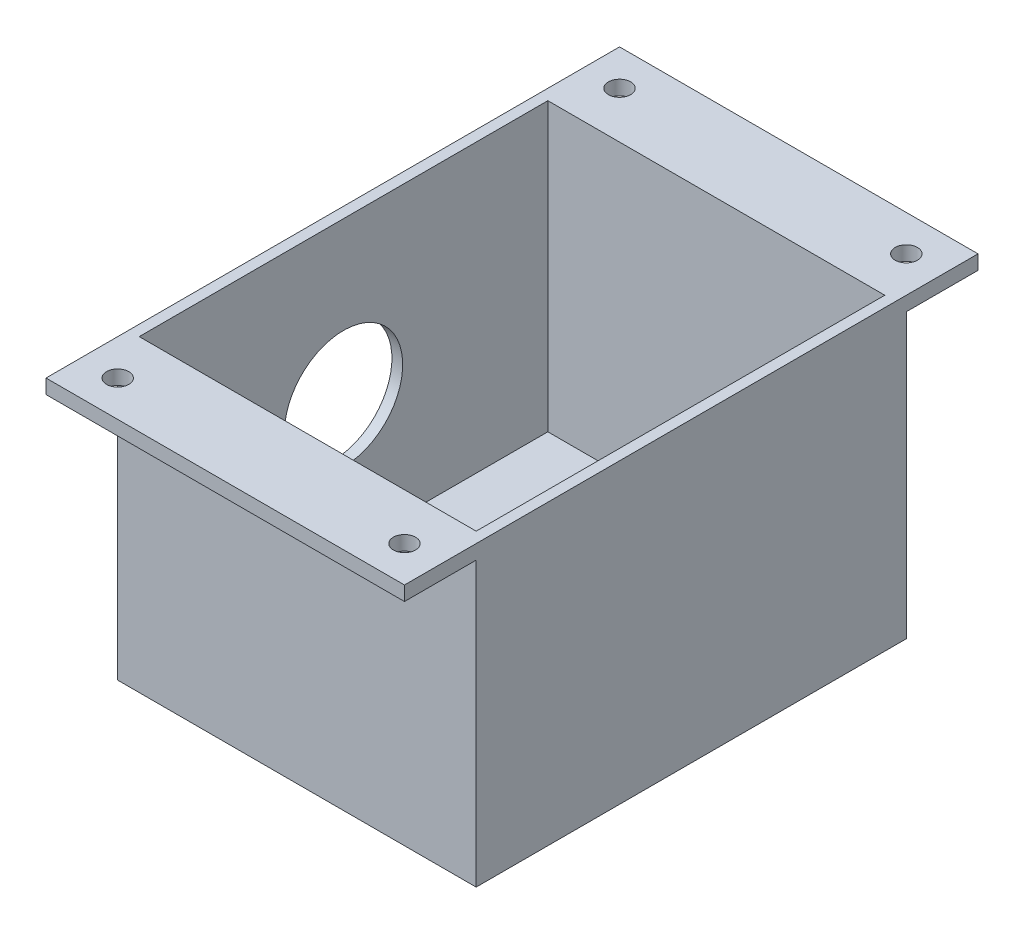
from build123d import *

# Parameters (mm, degrees)
SKETCH1_W           = 50
SKETCH1_H           = 60
SKETCH1_W_2         = 47
SKETCH1_H_2         = 57
BOSS_EXTRUDE6_DEPTH = 40
SKETCH7_W           = 50
SKETCH7_H           = 60
BOSS_EXTRUDE8_DEPTH = 1.5
SKETCH8_W           = 10
SKETCH8_H           = 2
BOSS_EXTRUDE9_DEPTH = 50
SKETCH9_R           = 1.55
CUT_EXTRUDE1_DEPTH  = 3
SKETCH11_R          = 8.25
CUT_EXTRUDE3_DEPTH  = 1.5


with BuildPart() as part:
    # Sketch1 → Boss-Extrude6 (new body)
    with BuildSketch(Plane(origin=(0, 0, 0), x_dir=(1, 0, 0), z_dir=(0, 1, 0))):
        Rectangle(SKETCH1_W, SKETCH1_H)
        Rectangle(SKETCH1_W_2, SKETCH1_H_2, mode=Mode.SUBTRACT)
    extrude(amount=BOSS_EXTRUDE6_DEPTH)

    # Sketch7 → Boss-Extrude8 (add)
    with BuildSketch(Plane.XZ):
        Rectangle(SKETCH7_W, SKETCH7_H)
    extrude(amount=BOSS_EXTRUDE8_DEPTH)

    # Sketch8 → Boss-Extrude9 (add)
    with BuildSketch(Plane(origin=(25, 0, 0), x_dir=(0, 0, -1), z_dir=(1, 0, 0))):
        with Locations((-35, 39)):
            Rectangle(SKETCH8_W, SKETCH8_H)
        with Locations((35, 39)):
            Rectangle(SKETCH8_W, SKETCH8_H)
    extrude(amount=-BOSS_EXTRUDE9_DEPTH)

    # Sketch9 → Cut-Extrude1 (cut)
    with BuildSketch(Plane(origin=(0, 40, 0), x_dir=(1, 0, 0), z_dir=(0, 1, 0))):
        with Locations((-20, 35)):
            Circle(SKETCH9_R)
        with Locations((20, 35)):
            Circle(SKETCH9_R)
        with Locations((20, -35)):
            Circle(SKETCH9_R)
        with Locations((-20, -35)):
            Circle(SKETCH9_R)
    extrude(amount=-CUT_EXTRUDE1_DEPTH, mode=Mode.SUBTRACT)

    # Sketch11 → Cut-Extrude3 (cut)
    with BuildSketch(Plane.ZY.offset(25)):
        with Locations((0, 18.25)):
            Circle(SKETCH11_R)
    extrude(amount=-CUT_EXTRUDE3_DEPTH, mode=Mode.SUBTRACT)


solid = part.part
